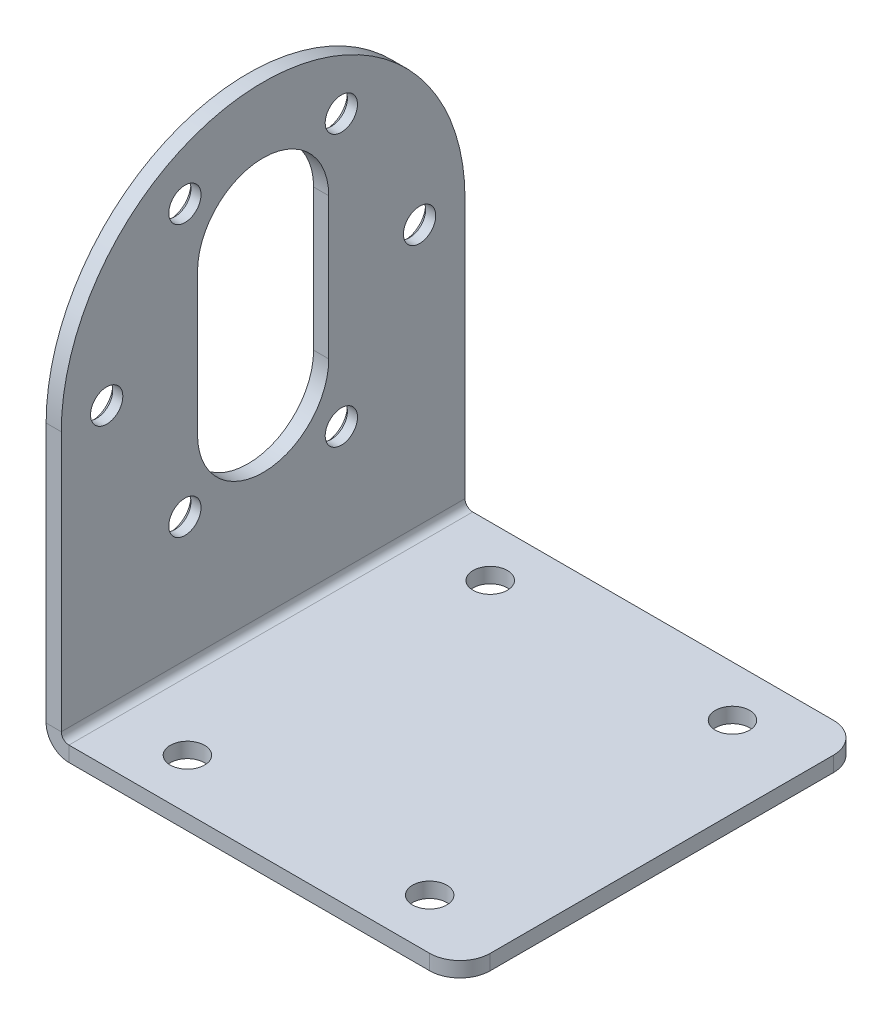
from build123d import *

# Parameters (mm, degrees)
BOSS_EXTRUDE1_DEPTH    = 1.5
SKETCH2_W              = 41
SKETCH2_H              = 40
BOSS_EXTRUDE2_DEPTH    = 1.5
CONVERT_SOLID1_START   = -20
CONVERT_SOLID1_DEPTH   = 40
CONVERT_SOLID1_2_DEPTH = 40
M3_CLEARANCE_HOLE1_D   = 3.2
CIRPATTERN1_COUNT      = 6
CUT_EXTRUDE1_DEPTH     = 54.525694764
M3_CLEARANCE_HOLE2_D   = 3.4
LPATTERN1_COUNT        = 2
LPATTERN1_PITCH        = 24
LPATTERN1_COPY_1_D     = 3.4
FILLET1_R              = 3
CHAMFER1_SIZE          = 0.5
CHAMFER2_SIZE          = 0.5


# Read off the part's stored shape, not the designer's step: Convert-Solid1
with BuildPart() as part:
    # Sketch1 → Boss-Extrude1 (new body)
    with BuildSketch(Plane(origin=(0, 0, 0), x_dir=(0, 0, -1), z_dir=(1, 0, 0))):
        with BuildLine():
            Line((-20, 0), (-20, -28))
            Line((-20, -28), (20, -28))
            Line((20, -28), (20, 0))
            ThreePointArc((20, 0), (0, 20), (-20, 0))
        make_face()
    extrude(amount=BOSS_EXTRUDE1_DEPTH)

    # Sketch2 → Boss-Extrude2 (add)
    with BuildSketch(Plane.XZ.offset(28)):
        with Locations((20.5, 0)):
            Rectangle(SKETCH2_W, SKETCH2_H)
    extrude(amount=-BOSS_EXTRUDE2_DEPTH)

    # Convert-Solid1 outline → Convert-Solid1 (cut)
    with BuildSketch(Plane.XY.offset(CONVERT_SOLID1_START)):
        with BuildLine():
            Line((0, -28), (2.262, -28))
            ThreePointArc((2.262, -28), (0.662524461, -27.337475539), (0, -25.738))
            Line((0, -25.738), (0, -28))
        make_face()
    extrude(amount=CONVERT_SOLID1_DEPTH, mode=Mode.SUBTRACT)

    # Convert-Solid1 2 outline → Convert-Solid1 2 (add)
    with BuildSketch(Plane.XY.offset(CONVERT_SOLID1_START)):
        with BuildLine():
            Line((1.5, -26.5), (2.262, -26.5))
            ThreePointArc((2.262, -26.5), (1.723184633, -26.276815367), (1.5, -25.738))
            Line((1.5, -25.738), (1.5, -26.5))
        make_face()
    extrude(amount=CONVERT_SOLID1_2_DEPTH)

    # M3 Clearance Hole1 (through all)
    with Locations(Plane.ZY):
        with Locations((-15.5, 0)):
            m3_clearance_hole1 = Hole(M3_CLEARANCE_HOLE1_D / 2)

    # CirPattern1: M3 Clearance Hole1 ×6 about axis
    cirpattern1_axis = Axis((0, 0, 0), (1, 0, 0))
    for i in range(1, CIRPATTERN1_COUNT):
        add(m3_clearance_hole1.rotate(cirpattern1_axis, i * 360 / CIRPATTERN1_COUNT), mode=Mode.SUBTRACT)

    # Sketch9 → Cut-Extrude1 (cut, through all)
    with BuildSketch(Plane.ZY):
        with BuildLine():
            Line((6.5, 7), (6.5, -7))
            ThreePointArc((6.5, -7), (0, -13.5), (-6.5, -7))
            Line((-6.5, -7), (-6.5, 7))
            ThreePointArc((-6.5, 7), (0, 13.5), (6.5, 7))
        make_face()
    extrude(amount=-CUT_EXTRUDE1_DEPTH, mode=Mode.SUBTRACT)

    # M3 Clearance Hole2 (through all)
    with Locations(Plane(origin=(0, -26.5, 0), x_dir=(1, 0, 0), z_dir=(0, 1, 0))):
        with Locations((33, 15)):
            m3_clearance_hole2 = Hole(M3_CLEARANCE_HOLE2_D / 2)

    # Mirror1: M3 Clearance Hole2 across plane
    add(m3_clearance_hole2.mirror(Plane.XY), mode=Mode.SUBTRACT)

    # LPattern1: M3 Clearance Hole2 ×2
    with Locations(*[(-i * LPATTERN1_PITCH, 0, 0) for i in range(1, LPATTERN1_COUNT)]):
        add(m3_clearance_hole2, mode=Mode.SUBTRACT)

    # LPattern1 copy 1 (through all)
    with Locations(Plane(origin=(-24, -26.5, 0), x_dir=(1, 0, 0), z_dir=(0, 1, 0))):
        with Locations((33, -15)):
            Hole(LPATTERN1_COPY_1_D / 2)

    # Fillet1
    fillet1_edges = [part.edges().sort_by_distance(p)[0] for p in [
        (41, -27.25, 20),
        (41, -27.25, -20),
    ]]
    fillet(fillet1_edges, radius=FILLET1_R)

    # Chamfer1
    chamfer1_edges = [part.edges().sort_by_distance(p)[0] for p in [
        (0, 12.037753113, -6.95),
    ]]
    chamfer(chamfer1_edges, length=CHAMFER1_SIZE)

    # Chamfer2
    chamfer2_edges = [part.edges().sort_by_distance(p)[0] for p in [
        (0, 0, -13.9),
        (0, 12.037753113, 6.95),
        (0, 0, 13.9),
        (0, -12.037753113, 6.95),
        (0, -12.037753113, -6.95),
    ]]
    chamfer(chamfer2_edges, length=CHAMFER2_SIZE)


solid = part.part
